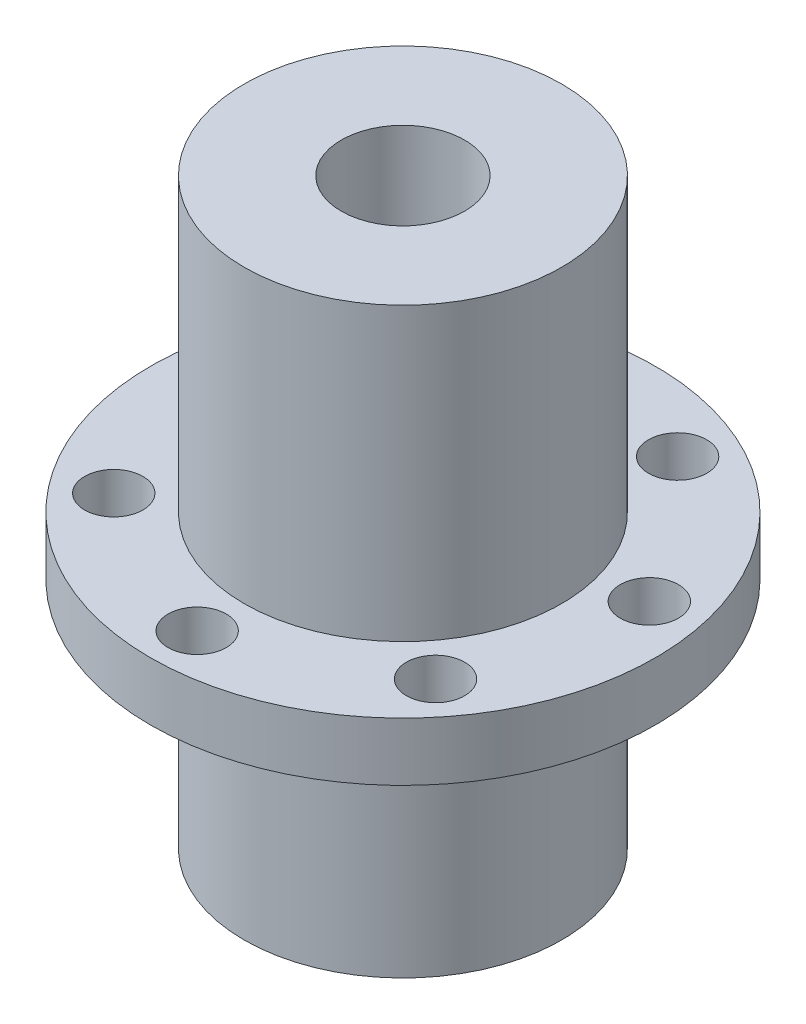
from build123d import *

# Parameters (mm, degrees)
BOSS_EXTRUDE1_DEPTH      = 15
BOSS_EXTRUDE1_DEPTH_BACK = 15
SKETCH1_R                = 8.175
SKETCH1_R_2              = 3.175
SKETCH1_3_R              = 13
SKETCH1_3_R_2            = 8.175
BOSS_EXTRUDE2_DEPTH      = 3
SKETCH2_R                = 2.5
CUT_EXTRUDE1_DEPTH       = 11
CUT_EXTRUDE2_DEPTH       = 36.185224257
CUT_EXTRUDE2_DEPTH_BACK  = 36.185224257
SKETCH3_R                = 1.5


with BuildPart() as part:
    # Sketch1 → Boss-Extrude1 (new, two sides: drawn at the far end of the back side and taken through both)
    with BuildSketch(Plane(origin=(0, 0, 0), x_dir=(1, 0, 0), z_dir=(0, 1, 0)).offset(-BOSS_EXTRUDE1_DEPTH_BACK)):
        Circle(SKETCH1_R)
        Circle(SKETCH1_R_2, mode=Mode.SUBTRACT)
    extrude(amount=BOSS_EXTRUDE1_DEPTH + BOSS_EXTRUDE1_DEPTH_BACK)

    # Sketch2 → Cut-Extrude1 (cut)
    with BuildSketch(Plane(origin=(0, 0, 0), x_dir=(0, 0, -1), z_dir=(1, 0, 0))):
        with Locations((0, 6.702870317)):
            Circle(SKETCH2_R)
    extrude(amount=-CUT_EXTRUDE1_DEPTH, mode=Mode.SUBTRACT)


with BuildPart() as body_2:
    # Sketch1<3> → Boss-Extrude2 (new body)
    with BuildSketch(Plane(origin=(0, 0, 0), x_dir=(1, 0, 0), z_dir=(0, 1, 0))):
        Circle(SKETCH1_3_R)
        Circle(SKETCH1_3_R_2, mode=Mode.SUBTRACT)
    extrude(amount=-BOSS_EXTRUDE2_DEPTH)

    # Sketch3 → Cut-Extrude2 (cut, two sides: drawn at the far end of the back side and taken through both)
    with BuildSketch(Plane.XZ.offset(15).offset(-CUT_EXTRUDE2_DEPTH_BACK)):
        with Locations((0, 10.594582185)):
            Circle(SKETCH3_R)
        with Locations((8.283177896, 6.605613948)):
            Circle(SKETCH3_R)
        with Locations((10.328953891, -2.357516323)):
            Circle(SKETCH3_R)
        with Locations((4.596816933, -9.545388718)):
            Circle(SKETCH3_R)
        with Locations((-4.596816933, -9.545388718)):
            Circle(SKETCH3_R)
        with Locations((-10.328953891, -2.357516323)):
            Circle(SKETCH3_R)
        with Locations((-8.283177896, 6.605613948)):
            Circle(SKETCH3_R)
    extrude(amount=CUT_EXTRUDE2_DEPTH + CUT_EXTRUDE2_DEPTH_BACK, mode=Mode.SUBTRACT)


solid = Compound([part.part, body_2.part])
